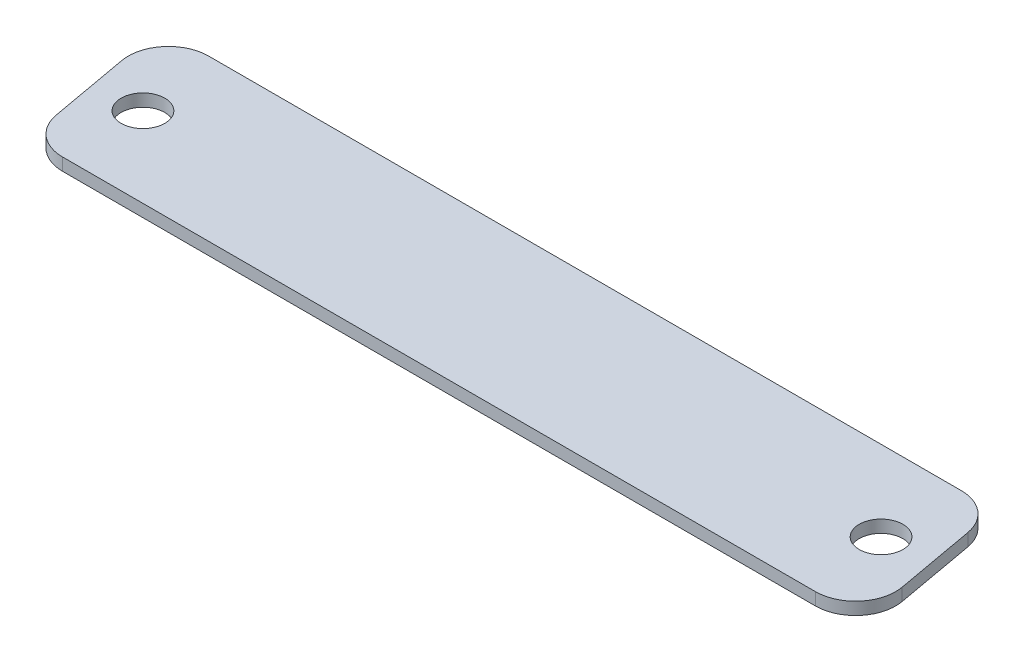
from build123d import *

# Parameters (mm, degrees)
SKETCH1_W          = 58.648623675
SKETCH1_H          = 10.16
BASE_FLANGE1_DEPTH = 0.7874
SKETCH3_R          = 1.3843
CUT_EXTRUDE1_DEPTH = 60.527360581
CUT_EXTRUDE2_DEPTH = 60.527360581
FILLET1_R          = 2.54


# Sheet-metal steps are written as plain solids
with BuildPart() as part:
    # Sketch1 → Base-Flange1 (new body)
    with BuildSketch(Plane(origin=(0, 0, 0), x_dir=(1, 0, 0), z_dir=(0, 1, 0))):
        with Locations((29.324311838, 5.08)):
            Rectangle(SKETCH1_W, SKETCH1_H)
    extrude(amount=-BASE_FLANGE1_DEPTH)

    # Sketch3 → Cut-Extrude1 (cut, through all)
    with BuildSketch(Plane.XZ.offset(0.7874)):
        with Locations(Location((52.793349192, -5.08, 0), (0, 0, 270))):
            Circle(SKETCH3_R)
        with Locations(Location((6.050755325, -5.08, 0), (0, 0, 270))):
            Circle(SKETCH3_R)
    extrude(amount=-CUT_EXTRUDE1_DEPTH, mode=Mode.SUBTRACT)

    # Sketch4 → Cut-Extrude2 (cut, through all)
    with BuildSketch(Plane.XZ.offset(0.7874)):
        Polygon((54.925303053, -10.16), (58.648623675, -10.16), (58.648623675, 0), (56.758255401, 0), align=None)
        Polygon((2.085849116, -10.16), (0, -10.16), (0, 0), (3.918801464, 0), align=None)
    extrude(amount=-CUT_EXTRUDE2_DEPTH, mode=Mode.SUBTRACT)

    # Fillet1
    fillet1_edges = [part.edges().sort_by_distance(p)[0] for p in [
        (3.918801464, -0.3937, 0),
        (2.085849116, -0.3937, -10.16),
        (54.925303053, -0.3937, -10.16),
        (56.758255401, -0.3937, 0),
    ]]
    fillet(fillet1_edges, radius=FILLET1_R)


solid = part.part
